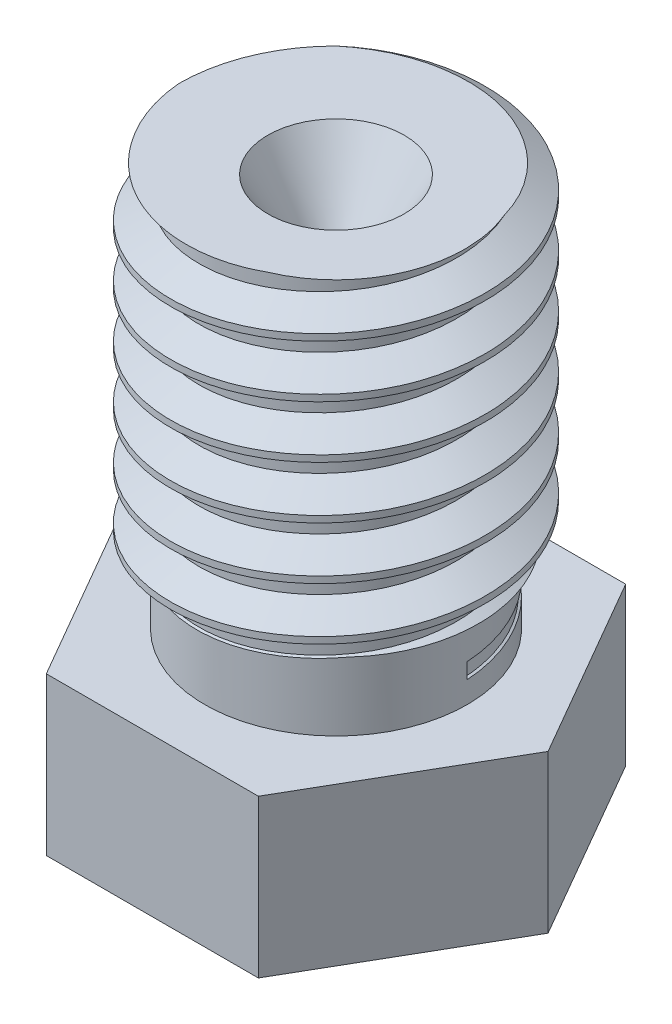
from build123d import *

# Parameters (mm, degrees)
SALIENTE_EXTRUIR2_START = -3
CROQUIS2_R              = 2.5
SALIENTE_EXTRUIR2_DEPTH = 3
ROSCA1_PITCH            = 1


with BuildPart() as part:
    # Croquis1 → Revolución1 (revolve)
    with BuildSketch(Plane.XY, mode=Mode.PRIVATE) as revoluci_n1_sk:
        Polygon((0.2, 0.6), (0.2, 0), (0.5, 0), (1.654700538, 2), (3.5, 2), (3.5, 5), (2.5, 5), (2.5, 6.3), (3, 6.5), (3, 12.5), (1.3, 12.5), (0.5, 11.114359354), (0.5, 1.119615242), align=None)
    revolve(revoluci_n1_sk.sketch.rotate(Axis((0, 0, 0), (0, 1, 0)), 90), axis=Axis((0, 0, 0), (0, 1, 0)))

    # Croquis2 → Saliente-Extruir2 (add)
    with BuildSketch(Plane.XZ.offset(-2).offset(SALIENTE_EXTRUIR2_START)):
        Polygon((4.041451884, 0), (2.020725942, 3.5), (-2.020725942, 3.5), (-4.041451884, 0), (-2.020725942, -3.5), (2.020725942, -3.5), align=None)
        with Locations(Location((0, 0, 0), (0, 0, 270))):
            Circle(CROQUIS2_R, mode=Mode.SUBTRACT)
    extrude(amount=SALIENTE_EXTRUIR2_DEPTH)

    # Rosca1: the profile of Perfil de rosca1 profile screwed along a right-hand helix of 7.5 turns, 8 arcs to a turn; built about Z, then put on its axis
    rosca1_z = Axis((0, 0, 0), (0, 0, 1))
    rosca1_corners = [(3.0003, 0, -0.000173205), (3.0003, 0, 0.875173202), (2.458734125, 0, 0.562499999), (2.458734125, 0, 0.312499999)]
    with BuildLine(mode=Mode.PRIVATE) as rosca1_profile:
        Line(rosca1_corners[0], rosca1_corners[1])
        Line(rosca1_corners[1], rosca1_corners[2])
        Line(rosca1_corners[2], rosca1_corners[3])
        Line(rosca1_corners[3], rosca1_corners[0])
    rosca1_cap = Face(rosca1_profile.wire())
    rosca1_turn_angles = [0, 22.5, 45, 67.5, 90, 112.5, 135, 157.5, 180, 202.5, 225, 247.5, 270, 292.5, 315, 337.5, 360]
    rosca1_turn_weights = [1, 0.9238795325112867, 1, 0.9238795325112867, 1, 0.9238795325112867, 1, 0.9238795325112867, 1, 0.9238795325112867, 1, 0.9238795325112867, 1, 0.9238795325112867, 1, 0.9238795325112867, 1]
    rosca1_turn_rails = [Edge.make_bspline([Vector(p[0], p[1], 0).rotate(rosca1_z, rosca1_turn_angles[k]) / rosca1_turn_weights[k] + Vector(0, 0, p[2] + ROSCA1_PITCH * rosca1_turn_angles[k] / 360) for k in range(17)], [0, 0, 0, 1, 1, 2, 2, 3, 3, 4, 4, 5, 5, 6, 6, 7, 7, 8, 8, 8], 2, rosca1_turn_weights) for p in rosca1_corners]
    rosca1_turn_sides = [Face.make_surface_from_curves(rosca1_turn_rails[p[0]], rosca1_turn_rails[p[1]]) for p in [(0, 1), (1, 2), (2, 3), (3, 0)]]
    rosca1_turn = Solid(Shell([*rosca1_turn_sides, rosca1_cap, rosca1_cap.rotate(rosca1_z, 360).moved(Location((0, 0, ROSCA1_PITCH * 360 / 360)))]))
    rosca1_last_angles = [2520, 2542.5, 2565, 2587.5, 2610, 2632.5, 2655, 2677.5, 2700]
    rosca1_last_weights = [1, 0.9238795325112867, 1, 0.9238795325112867, 1, 0.9238795325112867, 1, 0.9238795325112867, 1]
    rosca1_last_rails = [Edge.make_bspline([Vector(p[0], p[1], 0).rotate(rosca1_z, rosca1_last_angles[k]) / rosca1_last_weights[k] + Vector(0, 0, p[2] + ROSCA1_PITCH * rosca1_last_angles[k] / 360) for k in range(9)], [0, 0, 0, 1, 1, 2, 2, 3, 3, 4, 4, 4], 2, rosca1_last_weights) for p in rosca1_corners]
    rosca1_last_sides = [Face.make_surface_from_curves(rosca1_last_rails[p[0]], rosca1_last_rails[p[1]]) for p in [(0, 1), (1, 2), (2, 3), (3, 0)]]
    rosca1_last = Solid(Shell([*rosca1_last_sides, rosca1_cap.rotate(rosca1_z, 2520).moved(Location((0, 0, ROSCA1_PITCH * 2520 / 360))), rosca1_cap.rotate(rosca1_z, 2700).moved(Location((0, 0, ROSCA1_PITCH * 2700 / 360)))]))
    rosca1_each = [*[rosca1_turn.moved(Location((0, 0, ROSCA1_PITCH * i))) for i in range(7)], rosca1_last]
    add(Plane(origin=(0, 13.5, 0), x_dir=(-1, 0, 0), z_dir=(0, -1, 0)) * Compound([rosca1_each[i] for i in range(0, 8, 2)]), mode=Mode.SUBTRACT)
    add(Plane(origin=(0, 13.5, 0), x_dir=(-1, 0, 0), z_dir=(0, -1, 0)) * Compound([rosca1_each[i] for i in range(1, 8, 2)]), mode=Mode.SUBTRACT)


solid = part.part
